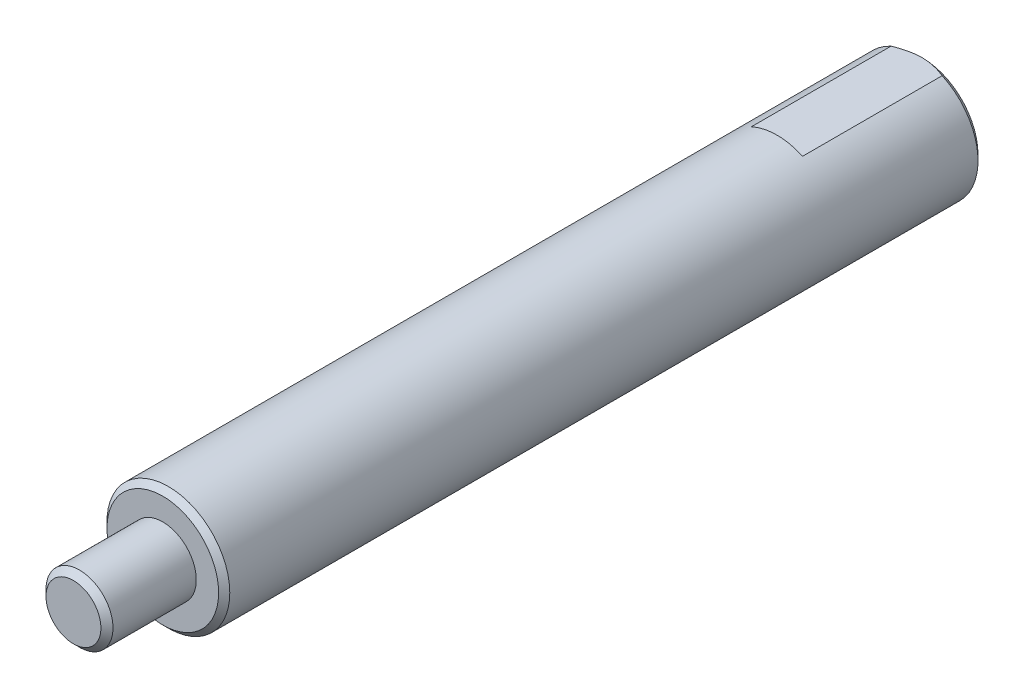
from build123d import *

# Parameters (mm, degrees)
SKETCH_1_R             = 5.5
EXTRUDE_1_DEPTH        = 68
CHAMFER_1_SIZE         = 0.5
SKETCH_2_R             = 3.3
EXTRUDE_2_DEPTH        = 8
HOLE_WIZARD_M5_1_D     = 4.2
HOLE_WIZARD_M5_1_DEPTH = 12.4
HOLE_WIZARD_M5_1_TIP   = 1.2618073
CHAMFER_3_SIZE         = 0.5
SKETCH_6_W             = 10
SKETCH_6_H             = 3
CUT_EXTRUDE_1_DEPTH    = 13


# Read off the part's stored shape, not the designer's step: M6 机械螺纹 螺柱1
with BuildPart() as part:
    # 草图1 → 拉伸1 (new body)
    with BuildSketch(Plane.XY):
        Circle(SKETCH_1_R)
    extrude(amount=EXTRUDE_1_DEPTH)

    # 倒角1
    chamfer_1_edges = [part.edges().sort_by_distance(p)[0] for p in [
        (-5.5, 0, 0),
        (-5.5, 0, 68),
    ]]
    chamfer(chamfer_1_edges, length=CHAMFER_1_SIZE)

    # 草图2 → 拉伸2 (add)
    with BuildSketch(Plane.XY.offset(68)):
        Circle(SKETCH_2_R)
    extrude(amount=EXTRUDE_2_DEPTH)

    # M5 螺纹孔1
    with Locations(Plane(origin=(0, 0, 0), x_dir=(-1, 0, 0), z_dir=(0, 0, -1))):
        with Locations((0, 0)):
            Hole(HOLE_WIZARD_M5_1_D / 2, depth=HOLE_WIZARD_M5_1_DEPTH)
            with Locations((0, 0, -(HOLE_WIZARD_M5_1_DEPTH + HOLE_WIZARD_M5_1_TIP / 2))):  # 118° drill point
                Cone(0, HOLE_WIZARD_M5_1_D / 2, HOLE_WIZARD_M5_1_TIP, mode=Mode.SUBTRACT)

    # 倒角3
    chamfer_3_edges = [part.edges().sort_by_distance(p)[0] for p in [
        (-2.1, 0, 0),
    ]]
    chamfer(chamfer_3_edges, length=CHAMFER_3_SIZE)

    # 草图6 → 切除-拉伸1 (cut)
    with BuildSketch(Plane(origin=(0, 0, 0), x_dir=(-1, 0, 0), z_dir=(0, 0, -1))):
        with Locations((0, 6.5)):
            Rectangle(SKETCH_6_W, SKETCH_6_H)
        with Locations((0, -6.5)):
            Rectangle(SKETCH_6_W, SKETCH_6_H)
    extrude(amount=-CUT_EXTRUDE_1_DEPTH, mode=Mode.SUBTRACT)

    # M6 机械螺纹 螺柱1 outline → M6 机械螺纹 螺柱1 (revolve, cut)
    with BuildSketch(Plane.XZ):
        Polygon((3.3, 76), (2.4585, 76), (3, 75.4585), (3, 68), (3.3, 68), align=None)
    revolve(axis=Axis((0, 0, 0), (0, 0, 1)), mode=Mode.SUBTRACT)


solid = part.part
